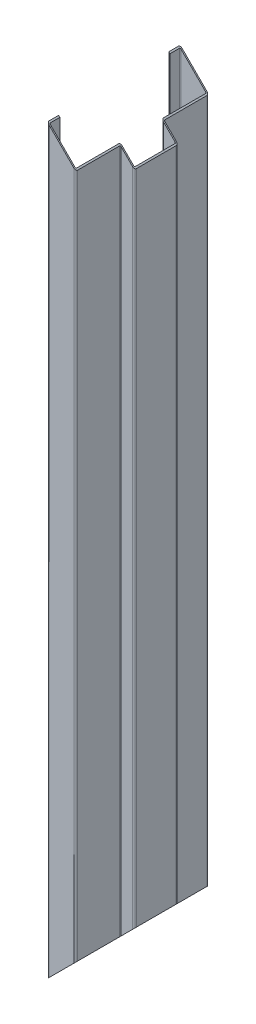
from build123d import *

# Parameters (mm, degrees)
BASE_FLANGE1_DEPTH = 390.5
CUT_EXTRUDE2_DEPTH = 419.369827425


# Sheet-metal steps are written as plain solids
with BuildPart() as part:
    # Sketch1 → Base-Flange1 (new, symmetric)
    with BuildSketch(Plane(origin=(0, 0, 0), x_dir=(1, 0, 0), z_dir=(0, 1, 0))):
        with BuildLine():
            Line((9.5, 58), (9.5, 68.0134))
            ThreePointArc((9.5, 68.0134), (10.081861668, 69.418138332), (11.4866, 70))
            Line((11.4866, 70), (37.5134, 70))
            ThreePointArc((37.5134, 70), (38.918138332, 69.418138332), (39.5, 68.0134))
            Line((39.5, 68.0134), (39.5, 23.7366))
            ThreePointArc((39.5, 23.7366), (39.715745145, 23.215745145), (40.2366, 23))
            Line((40.2366, 23), (52.2634, 23))
            ThreePointArc((52.2634, 23), (53.668138332, 22.418138332), (54.25, 21.0134))
            Line((54.25, 21.0134), (54.25, 18))
            Line((54.25, 18), (54.25, -21.0134))
            ThreePointArc((54.25, -21.0134), (53.668138332, -22.418138332), (52.2634, -23))
            Line((52.2634, -23), (40.2366, -23))
            ThreePointArc((40.2366, -23), (39.715745145, -23.215745145), (39.5, -23.7366))
            Line((39.5, -23.7366), (39.5, -68.0134))
            ThreePointArc((39.5, -68.0134), (38.918138332, -69.418138332), (37.5134, -70))
            Line((37.5134, -70), (11.4866, -70))
            ThreePointArc((11.4866, -70), (10.081861668, -69.418138332), (9.5, -68.0134))
            Line((9.5, -68.0134), (9.5, -58))
            Line((9.5, -58), (10.75, -58))
            Line((10.75, -58), (10.75, -68.0134))
            ThreePointArc((10.75, -68.0134), (10.965745145, -68.534254855), (11.4866, -68.75))
            Line((11.4866, -68.75), (37.5134, -68.75))
            ThreePointArc((37.5134, -68.75), (38.034254855, -68.534254855), (38.25, -68.0134))
            Line((38.25, -68.0134), (38.25, -23.7366))
            ThreePointArc((38.25, -23.7366), (38.831861668, -22.331861668), (40.2366, -21.75))
            Line((40.2366, -21.75), (52.2634, -21.75))
            ThreePointArc((52.2634, -21.75), (52.784254855, -21.534254855), (53, -21.0134))
            Line((53, -21.0134), (53, 18))
            Line((53, 18), (53, 21.0134))
            ThreePointArc((53, 21.0134), (52.784254855, 21.534254855), (52.2634, 21.75))
            Line((52.2634, 21.75), (40.2366, 21.75))
            ThreePointArc((40.2366, 21.75), (38.831861668, 22.331861668), (38.25, 23.7366))
            Line((38.25, 23.7366), (38.25, 68.0134))
            ThreePointArc((38.25, 68.0134), (38.034254855, 68.534254855), (37.5134, 68.75))
            Line((37.5134, 68.75), (11.4866, 68.75))
            ThreePointArc((11.4866, 68.75), (10.965745145, 68.534254855), (10.75, 68.0134))
            Line((10.75, 68.0134), (10.75, 58))
            Line((10.75, 58), (9.5, 58))
        make_face()
    extrude(amount=BASE_FLANGE1_DEPTH, both=True)

    # Sketch2 → Cut-Extrude2 (cut, through all)
    with BuildSketch(Plane.XY.offset(70)):
        Polygon((9.5, -390.5), (204.29871247, -195.70128753), (123.087268974, -390.5), align=None)
        Polygon((123.087268974, 390.5), (9.5, 390.5), (204.29871247, 195.70128753), align=None)
    extrude(amount=-CUT_EXTRUDE2_DEPTH, mode=Mode.SUBTRACT)


solid = part.part
